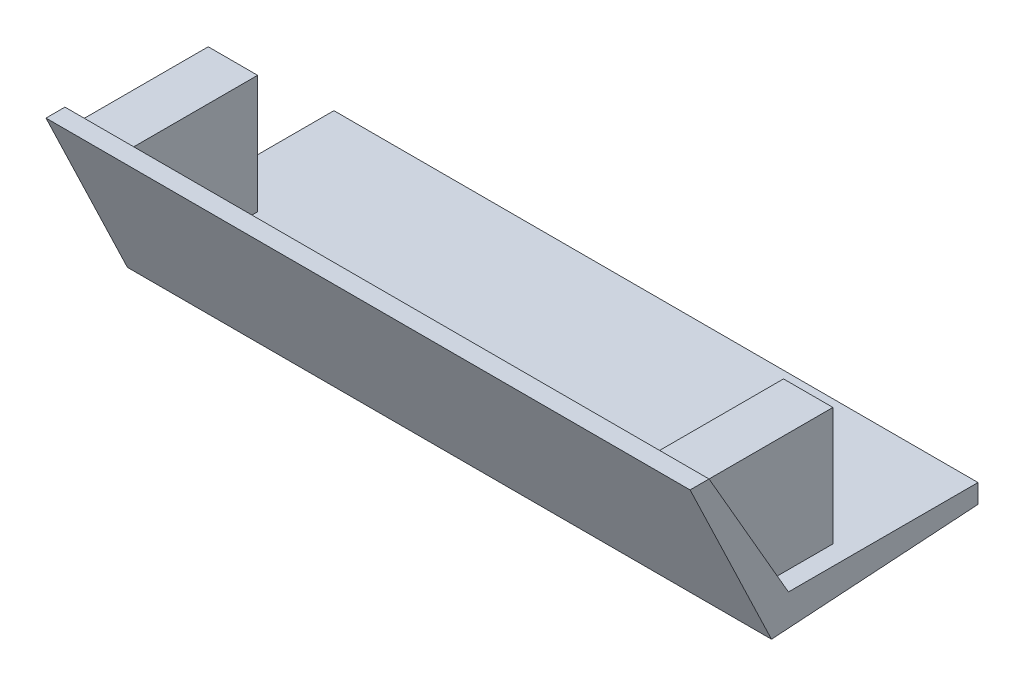
from build123d import *

# Parameters (mm, degrees)
BOSS_EXTRUDE2_DEPTH             = 118.925
BOSS_EXTRUDE1_REACH             = 149.05
SKETCH2_W                       = 18.25
SKETCH2_H                       = 43.65
BOSS_EXTRUDE1_DIRECTION_2_DEPTH = 20


with BuildPart() as part:
    # Sketch1 → Boss-Extrude2 (new, symmetric)
    with BuildSketch(Plane(origin=(0, 0, 0), x_dir=(0, 0, -1), z_dir=(1, 0, 0))):
        Polygon((0, 0), (-29.329393675, 50.8), (-36.329393675, 50.8), (-6.252899132, -12), (70, -7), (70, 0), align=None)
    extrude(amount=BOSS_EXTRUDE2_DEPTH, both=True)

    # Boss-Extrude1: up to this plane
    boss_extrude1_end = Plane(origin=(118.925, 0, 0), z_dir=(0, -0.5000000000000043, 0.8660254037844363))
    # Sketch2 → Boss-Extrude1 (add, up to the surface)
    with BuildSketch(Plane.XY, mode=Mode.PRIVATE) as boss_extrude1_sk1:
        with Locations((106.225, 25.4)):
            Rectangle(SKETCH2_W, SKETCH2_H)
    boss_extrude1_tool1 = split(extrude(boss_extrude1_sk1.sketch, amount=BOSS_EXTRUDE1_REACH, mode=Mode.PRIVATE), bisect_by=boss_extrude1_end, keep=Keep.BOTH, mode=Mode.PRIVATE)
    add(boss_extrude1_tool1.solids().sort_by_distance((106.225, 25.4, 0))[0])
    # Sketch2 → Boss-Extrude1 (add, up to the surface)
    with BuildSketch(Plane.XY, mode=Mode.PRIVATE) as boss_extrude1_sk2:
        with Locations((-106.225, 25.4)):
            Rectangle(SKETCH2_W, SKETCH2_H)
    boss_extrude1_tool2 = split(extrude(boss_extrude1_sk2.sketch, amount=BOSS_EXTRUDE1_REACH, mode=Mode.PRIVATE), bisect_by=boss_extrude1_end, keep=Keep.BOTH, mode=Mode.PRIVATE)
    add(boss_extrude1_tool2.solids().sort_by_distance((-106.225, 25.4, 0))[0])

    # Sketch2 → Boss-Extrude1 direction 2 (add)
    with BuildSketch(Plane.XY):
        with Locations((106.225, 25.4)):
            Rectangle(SKETCH2_W, SKETCH2_H)
        with Locations((-106.225, 25.4)):
            Rectangle(SKETCH2_W, SKETCH2_H)
    extrude(amount=-BOSS_EXTRUDE1_DIRECTION_2_DEPTH)


solid = part.part
